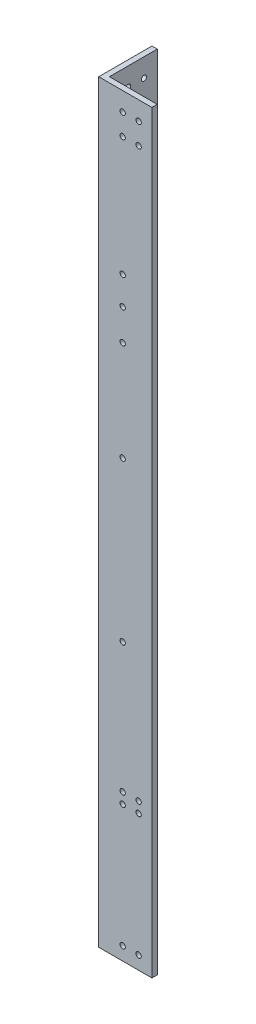
from build123d import *

# Parameters (mm, degrees)
BOSS_EXTRUDE1_DEPTH               = 450
FRONTSIDEHOLES_SKETCH3_R          = 1.5875
FRONTSIDEHOLES_CUT_EXTRUDE1_DEPTH = 3.175
LEFTSIDEHOLES_SKETCH4_R           = 1.5875
LEFTSIDEHOLES_SKETCH4_R_2         = 7.02535835
LEFTSIDEHOLES_SKETCH4_R_3         = 7.171581513
LEFTSIDEHOLES_SKETCH4_R_4         = 6.619921397
LEFTSIDEHOLES_CUT_EXTRUDE2_DEPTH  = 3.175


with BuildPart() as part:
    # Sketch2 → Boss-Extrude1 (new body)
    with BuildSketch(Plane(origin=(0, 0, 0), x_dir=(1, 0, 0), z_dir=(0, 1, 0))):
        Polygon((0, 31.75), (3.175, 31.75), (3.175, 3.175), (31.75, 3.175), (31.75, 0), (0, 0), align=None)
    extrude(amount=BOSS_EXTRUDE1_DEPTH)

    # FrontSideHoles-Sketch3 → FrontSideHoles-Cut-Extrude1 (cut)
    with BuildSketch(Plane.XY):
        with Locations((14.2875, 81.1125)):
            Circle(FRONTSIDEHOLES_SKETCH3_R)
        with Locations((23.8125, 81.1125)):
            Circle(FRONTSIDEHOLES_SKETCH3_R)
        with Locations((14.2875, 87.4625)):
            Circle(FRONTSIDEHOLES_SKETCH3_R)
        with Locations((23.8125, 87.4625)):
            Circle(FRONTSIDEHOLES_SKETCH3_R)
        with Locations((14.2875, 438.8875)):
            Circle(FRONTSIDEHOLES_SKETCH3_R)
        with Locations((14.2875, 426.1875)):
            Circle(FRONTSIDEHOLES_SKETCH3_R)
        with Locations((23.8125, 438.8875)):
            Circle(FRONTSIDEHOLES_SKETCH3_R)
        with Locations((23.8125, 426.1875)):
            Circle(FRONTSIDEHOLES_SKETCH3_R)
        with Locations((14.2875, 338.177644)):
            Circle(FRONTSIDEHOLES_SKETCH3_R)
        with Locations((14.2875, 319.652644)):
            Circle(FRONTSIDEHOLES_SKETCH3_R)
        with Locations((14.2875, 260)):
            Circle(FRONTSIDEHOLES_SKETCH3_R)
        with Locations((14.2875, 165)):
            Circle(FRONTSIDEHOLES_SKETCH3_R)
        with Locations((14.2875, 355)):
            Circle(FRONTSIDEHOLES_SKETCH3_R)
        with Locations((14.2875, 7.9375)):
            Circle(FRONTSIDEHOLES_SKETCH3_R)
        with Locations((23.8125, 7.9375)):
            Circle(FRONTSIDEHOLES_SKETCH3_R)
    extrude(amount=-FRONTSIDEHOLES_CUT_EXTRUDE1_DEPTH, mode=Mode.SUBTRACT)

    # LeftSideHoles-Sketch4 → LeftSideHoles-Cut-Extrude2 (cut)
    with BuildSketch(Plane.ZY):
        with Locations((-23.8125, 81.1125)):
            Circle(LEFTSIDEHOLES_SKETCH4_R)
        with Locations((-14.2875, 81.1125)):
            Circle(LEFTSIDEHOLES_SKETCH4_R)
        with Locations((-23.8125, 87.4625)):
            Circle(LEFTSIDEHOLES_SKETCH4_R)
        with Locations((-14.2875, 87.4625)):
            Circle(LEFTSIDEHOLES_SKETCH4_R)
        with Locations((-23.8125, 438.8875)):
            Circle(LEFTSIDEHOLES_SKETCH4_R)
        with Locations((-14.2875, 438.8875)):
            Circle(LEFTSIDEHOLES_SKETCH4_R)
        with Locations((-23.8125, 426.1875)):
            Circle(LEFTSIDEHOLES_SKETCH4_R)
        with Locations((-14.2875, 426.1875)):
            Circle(LEFTSIDEHOLES_SKETCH4_R)
        with Locations((-23.8125, 332.602644)):
            Circle(LEFTSIDEHOLES_SKETCH4_R)
        with Locations((-14.2875, 332.602644)):
            Circle(LEFTSIDEHOLES_SKETCH4_R)
        with Locations((-23.8125, 319.902644)):
            Circle(LEFTSIDEHOLES_SKETCH4_R)
        with Locations((-14.2875, 319.902644)):
            Circle(LEFTSIDEHOLES_SKETCH4_R)
        with Locations((-23.8125, 7.9375)):
            Circle(LEFTSIDEHOLES_SKETCH4_R)
        with Locations((-14.2875, 7.9375)):
            Circle(LEFTSIDEHOLES_SKETCH4_R)
        with Locations((-14.2875, 165)):
            Circle(LEFTSIDEHOLES_SKETCH4_R_2)
        with Locations((-14.2875, 260)):
            Circle(LEFTSIDEHOLES_SKETCH4_R_3)
        with Locations((-14.2875, 355)):
            Circle(LEFTSIDEHOLES_SKETCH4_R_4)
    extrude(amount=-LEFTSIDEHOLES_CUT_EXTRUDE2_DEPTH, mode=Mode.SUBTRACT)


solid = part.part
